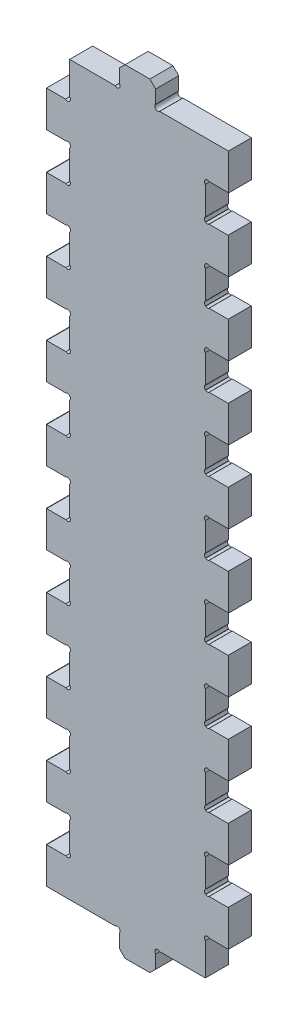
from build123d import *

# Parameters (mm, degrees)
BOSS_EXTRUDE1_DEPTH = 6.35
CHAMFER1_SIZE       = 1.5875
SKETCH1_W           = 6.288243006
SKETCH1_H           = 10.1524
SKETCH1_W_2         = 6.300894721
CUT_EXTRUDE1_DEPTH  = 213.416207009
LPATTERN1_COUNT     = 9
LPATTERN1_PITCH     = 20


# Read off the part's stored shape, not the designer's step: Boss-Extrude1
with BuildPart() as part:
    # Boss-Extrude1 outline → Boss-Extrude1 (new body)
    with BuildSketch(Plane.XY):
        with BuildLine():
            Line((43.65, 81.122532015), (43.65, 88.877467985))
            ThreePointArc((43.65, 88.877467985), (43.65, 90), (44.772532015, 90))
            Line((44.772532015, 90), (50, 90))
            Line((50, 90), (50, 100))
            Line((50, 100), (44.772532015, 100))
            ThreePointArc((44.772532015, 100), (43.65, 100), (43.65, 101.122532015))
            Line((43.65, 101.122532015), (43.65, 108.877467985))
            ThreePointArc((43.65, 108.877467985), (43.65, 110), (44.772532015, 110))
            Line((44.772532015, 110), (50, 110))
            Line((50, 110), (50, 120))
            Line((50, 120), (44.772532015, 120))
            ThreePointArc((44.772532015, 120), (43.65, 120), (43.65, 121.122532015))
            Line((43.65, 121.122532015), (43.65, 128.877467985))
            ThreePointArc((43.65, 128.877467985), (43.65, 130), (44.772532015, 130))
            Line((44.772532015, 130), (50, 130))
            Line((50, 130), (50, 140))
            Line((50, 140), (44.772532015, 140))
            ThreePointArc((44.772532015, 140), (43.65, 140), (43.65, 141.122532015))
            Line((43.65, 141.122532015), (43.65, 148.877467985))
            ThreePointArc((43.65, 148.877467985), (43.65, 150), (44.772532015, 150))
            Line((44.772532015, 150), (50, 150))
            Line((50, 150), (50, 160))
            Line((50, 160), (44.772532015, 160))
            ThreePointArc((44.772532015, 160), (43.65, 160), (43.65, 161.122532015))
            Line((43.65, 161.122532015), (43.65, 168.877467985))
            ThreePointArc((43.65, 168.877467985), (43.65, 170), (44.772532015, 170))
            Line((44.772532015, 170), (50, 170))
            Line((50, 170), (50, 180))
            Line((50, 180), (44.772532015, 180))
            ThreePointArc((44.772532015, 180), (43.65, 180), (43.65, 181.122532015))
            Line((43.65, 181.122532015), (43.65, 188.877467985))
            ThreePointArc((43.65, 188.877467985), (43.65, 190), (44.772532015, 190))
            Line((44.772532015, 190), (50, 190))
            Line((50, 190), (50, 200))
            Line((50, 200), (31.122532015, 200))
            ThreePointArc((31.122532015, 200), (30, 200), (30, 201.122532015))
            Line((30, 201.122532015), (30, 206.35))
            Line((30, 206.35), (20, 206.35))
            Line((20, 206.35), (20, 201.122532015))
            ThreePointArc((20, 201.122532015), (20, 200), (18.877467985, 200))
            Line((18.877467985, 200), (6.35, 200))
            Line((6.35, 200), (6.35, 191.122532015))
            ThreePointArc((6.35, 191.122532015), (6.35, 190), (5.227467985, 190))
            Line((5.227467985, 190), (0, 190))
            Line((0, 190), (0, 180))
            Line((0, 180), (5.227467985, 180))
            ThreePointArc((5.227467985, 180), (6.35, 180), (6.35, 178.877467985))
            Line((6.35, 178.877467985), (6.35, 171.122532015))
            ThreePointArc((6.35, 171.122532015), (6.35, 170), (5.227467985, 170))
            Line((5.227467985, 170), (0, 170))
            Line((0, 170), (0, 160))
            Line((0, 160), (5.227467985, 160))
            ThreePointArc((5.227467985, 160), (6.35, 160), (6.35, 158.877467985))
            Line((6.35, 158.877467985), (6.35, 151.122532015))
            ThreePointArc((6.35, 151.122532015), (6.35, 150), (5.227467985, 150))
            Line((5.227467985, 150), (0, 150))
            Line((0, 150), (0, 140))
            Line((0, 140), (5.227467985, 140))
            ThreePointArc((5.227467985, 140), (6.35, 140), (6.35, 138.877467985))
            Line((6.35, 138.877467985), (6.35, 131.122532015))
            ThreePointArc((6.35, 131.122532015), (6.35, 130), (5.227467985, 130))
            Line((5.227467985, 130), (0, 130))
            Line((0, 130), (0, 120))
            Line((0, 120), (5.227467985, 120))
            ThreePointArc((5.227467985, 120), (6.35, 120), (6.35, 118.877467985))
            Line((6.35, 118.877467985), (6.35, 111.122532015))
            ThreePointArc((6.35, 111.122532015), (6.35, 110), (5.227467985, 110))
            Line((5.227467985, 110), (0, 110))
            Line((0, 110), (0, 100))
            Line((0, 100), (5.227467985, 100))
            ThreePointArc((5.227467985, 100), (6.35, 100), (6.35, 98.877467985))
            Line((6.35, 98.877467985), (6.35, 91.122532015))
            ThreePointArc((6.35, 91.122532015), (6.35, 90), (5.227467985, 90))
            Line((5.227467985, 90), (0, 90))
            Line((0, 90), (0, 80))
            Line((0, 80), (5.227467985, 80))
            ThreePointArc((5.227467985, 80), (6.35, 80), (6.35, 78.877467985))
            Line((6.35, 78.877467985), (6.35, 71.122532015))
            ThreePointArc((6.35, 71.122532015), (6.35, 70), (5.227467985, 70))
            Line((5.227467985, 70), (0, 70))
            Line((0, 70), (0, 60))
            Line((0, 60), (5.227467985, 60))
            ThreePointArc((5.227467985, 60), (6.35, 60), (6.35, 58.877467985))
            Line((6.35, 58.877467985), (6.35, 51.122532015))
            ThreePointArc((6.35, 51.122532015), (6.35, 50), (5.227467985, 50))
            Line((5.227467985, 50), (0, 50))
            Line((0, 50), (0, 40))
            Line((0, 40), (5.227467985, 40))
            ThreePointArc((5.227467985, 40), (6.35, 40), (6.35, 38.877467985))
            Line((6.35, 38.877467985), (6.35, 31.122532015))
            ThreePointArc((6.35, 31.122532015), (6.35, 30), (5.227467985, 30))
            Line((5.227467985, 30), (0, 30))
            Line((0, 30), (0, 20))
            Line((0, 20), (5.227467985, 20))
            ThreePointArc((5.227467985, 20), (6.35, 20), (6.35, 18.877467985))
            Line((6.35, 18.877467985), (6.35, 11.122532015))
            ThreePointArc((6.35, 11.122532015), (6.35, 10), (5.227467985, 10))
            Line((5.227467985, 10), (0, 10))
            Line((0, 10), (0, 0))
            Line((0, 0), (18.877467985, 0))
            ThreePointArc((18.877467985, 0), (20, 0), (20, -1.122532015))
            Line((20, -1.122532015), (20, -6.35))
            Line((20, -6.35), (30, -6.35))
            Line((30, -6.35), (30, -1.122532015))
            ThreePointArc((30, -1.122532015), (30, 0), (31.122532015, 0))
            Line((31.122532015, 0), (43.65, 0))
            Line((43.65, 0), (43.65, 8.877467985))
            ThreePointArc((43.65, 8.877467985), (43.65, 10), (44.772532015, 10))
            Line((44.772532015, 10), (50, 10))
            Line((50, 10), (50, 20))
            Line((50, 20), (44.772532015, 20))
            ThreePointArc((44.772532015, 20), (43.65, 20), (43.65, 21.122532015))
            Line((43.65, 21.122532015), (43.65, 28.877467985))
            ThreePointArc((43.65, 28.877467985), (43.65, 30), (44.772532015, 30))
            Line((44.772532015, 30), (50, 30))
            Line((50, 30), (50, 40))
            Line((50, 40), (44.772532015, 40))
            ThreePointArc((44.772532015, 40), (43.65, 40), (43.65, 41.122532015))
            Line((43.65, 41.122532015), (43.65, 48.877467985))
            ThreePointArc((43.65, 48.877467985), (43.65, 50), (44.772532015, 50))
            Line((44.772532015, 50), (50, 50))
            Line((50, 50), (50, 60))
            Line((50, 60), (44.772532015, 60))
            ThreePointArc((44.772532015, 60), (43.65, 60), (43.65, 61.122532015))
            Line((43.65, 61.122532015), (43.65, 68.877467985))
            ThreePointArc((43.65, 68.877467985), (43.65, 70), (44.772532015, 70))
            Line((44.772532015, 70), (50, 70))
            Line((50, 70), (50, 80))
            Line((50, 80), (44.772532015, 80))
            ThreePointArc((44.772532015, 80), (43.65, 80), (43.65, 81.122532015))
        make_face()
    extrude(amount=BOSS_EXTRUDE1_DEPTH)

    # Chamfer1
    chamfer1_edges = [part.edges().sort_by_distance(p)[0] for p in [
        (30, -6.35, 3.175),
        (20, -6.35, 3.175),
        (20, 206.35, 3.175),
        (30, 206.35, 3.175),
    ]]
    chamfer(chamfer1_edges, length=CHAMFER1_SIZE)

    # Sketch1 → Cut-Extrude1 (cut, through all)
    with BuildSketch(Plane.XY.offset(6.35)):
        with Locations((3.175005578, 175)):
            Rectangle(SKETCH1_W, SKETCH1_H)
        with Locations((46.824995526, 185)):
            Rectangle(SKETCH1_W_2, SKETCH1_H)
    cut_extrude1 = extrude(amount=-CUT_EXTRUDE1_DEPTH, mode=Mode.SUBTRACT)

    # LPattern1: Cut-Extrude1 ×9
    with Locations(*[(0, -i * LPATTERN1_PITCH, 0) for i in range(1, LPATTERN1_COUNT)]):
        add(cut_extrude1, mode=Mode.SUBTRACT)


solid = part.part
